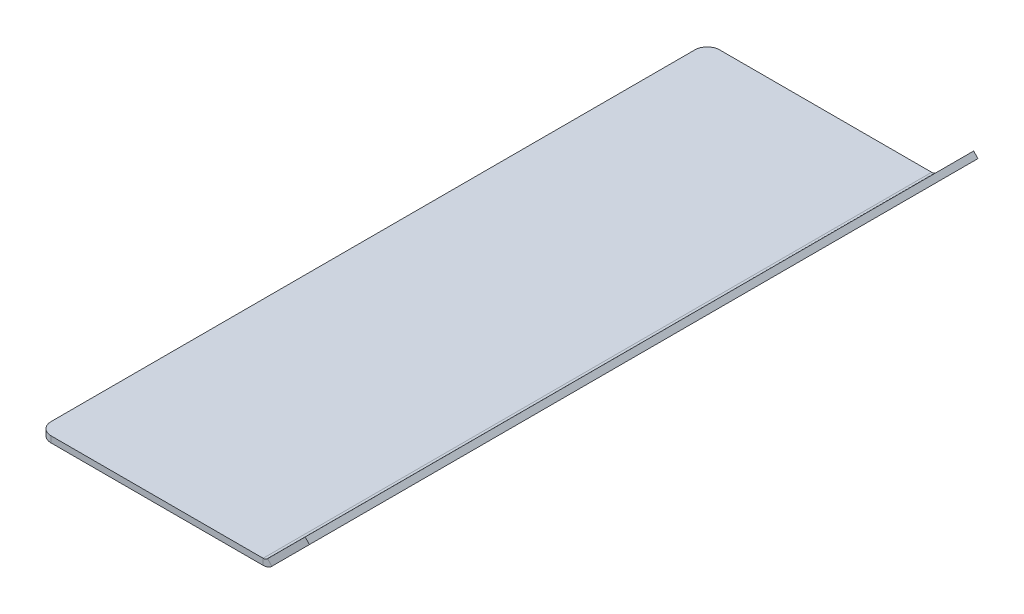
from build123d import *

# Parameters (mm, degrees)
T_LE_DE_BASE_PLI_E1_DEPTH                      = 324
CONG_1_R                                       = 6
FRAISAGE_POUR_VIS_T_TE_FRAIS_E_M61_D           = 6.6
FRAISAGE_POUR_VIS_T_TE_FRAIS_E_M61_CSINK_D     = 12.6
FRAISAGE_POUR_VIS_T_TE_FRAIS_E_M61_CSINK_ANGLE = 90


# Sheet-metal steps are written as plain solids
with BuildPart() as part:
    # Esquisse1 → Tôle de base pliée1 (new body)
    with BuildSketch(Plane.XY):
        with BuildLine():
            Line((0, 0), (108.757359313, 0))
            ThreePointArc((108.757359313, 0), (109.90540961, 0.228361402), (110.878679656, 0.878679656))
            Line((110.878679656, 0.878679656), (129.091883092, 19.091883092))
            Line((129.091883092, 19.091883092), (131.213203436, 16.970562748))
            Line((131.213203436, 16.970562748), (113, -1.242640687))
            ThreePointArc((113, -1.242640687), (111.053459907, -2.543277195), (108.757359313, -3))
            Line((108.757359313, -3), (0, -3))
            Line((0, -3), (0, 0))
        make_face()
    extrude(amount=T_LE_DE_BASE_PLI_E1_DEPTH)

    # Congé1
    cong_1_edges = [part.edges().sort_by_distance(p)[0] for p in [
        (0, -1.5, 324),
        (0, -1.5, 0),
    ]]
    fillet(cong_1_edges, radius=CONG_1_R)

    # Fraisage pour vis à tête fraisée M61 (through all)
    with Locations(Plane(origin=(55, -55, 0), x_dir=(0, 0, 1), z_dir=(-0.707106781186549, 0.707106781186546, 0))):
        with Locations((279.5, 93.781745931), (162, 93.781745931), (44.5, 93.781745931)):
            CounterSinkHole(FRAISAGE_POUR_VIS_T_TE_FRAIS_E_M61_D / 2, FRAISAGE_POUR_VIS_T_TE_FRAIS_E_M61_CSINK_D / 2, counter_sink_angle=FRAISAGE_POUR_VIS_T_TE_FRAIS_E_M61_CSINK_ANGLE)


solid = part.part
